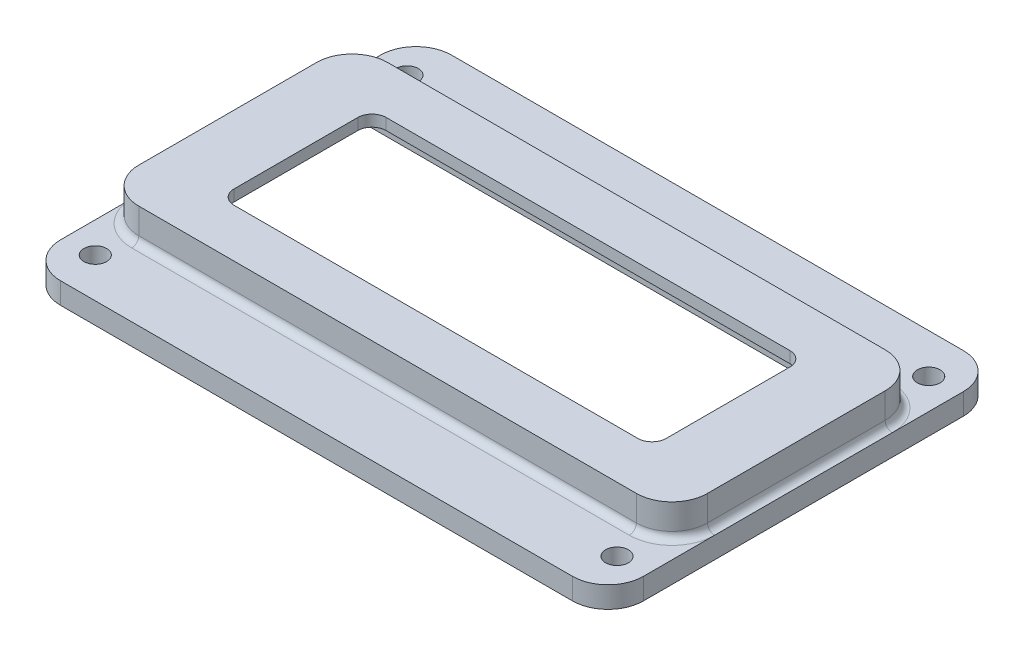
from build123d import *

# Parameters (mm, degrees)
SKETCH1_W           = 104.14
SKETCH1_H           = 69.85
BOSS_EXTRUDE1_DEPTH = 3.81
SKETCH2_W           = 101.6
SKETCH2_H           = 44.45
BOSS_EXTRUDE2_DEPTH = 5.842
SKETCH4_W           = 97.536
SKETCH4_H           = 40.64
CUT_EXTRUDE1_DEPTH  = 7.62
SKETCH5_W           = 77.216
SKETCH5_H           = 27.178
CUT_EXTRUDE2_DEPTH  = 5.842
FILLET1_R           = 2.54
FILLET2_R           = 6.35
FILLET3_R           = 1.27
SKETCH6_R           = 2.032
CUT_EXTRUDE3_DEPTH  = 5.842
FILLET4_R           = 1.27


with BuildPart() as part:
    # Sketch1 → Boss-Extrude1 (new body)
    with BuildSketch(Plane(origin=(0, 0, 0), x_dir=(1, 0, 0), z_dir=(0, 1, 0))):
        Rectangle(SKETCH1_W, SKETCH1_H)
    extrude(amount=BOSS_EXTRUDE1_DEPTH)

    # Sketch2 → Boss-Extrude2 (add)
    with BuildSketch(Plane(origin=(0, 3.81, 0), x_dir=(1, 0, 0), z_dir=(0, 1, 0))):
        Rectangle(SKETCH2_W, SKETCH2_H)
    extrude(amount=BOSS_EXTRUDE2_DEPTH)

    # Sketch4 → Cut-Extrude1 (cut)
    with BuildSketch(Plane.XZ):
        Rectangle(SKETCH4_W, SKETCH4_H)
    extrude(amount=-CUT_EXTRUDE1_DEPTH, mode=Mode.SUBTRACT)

    # Sketch5 → Cut-Extrude2 (cut)
    with BuildSketch(Plane.XZ.offset(-7.62)):
        Rectangle(SKETCH5_W, SKETCH5_H)
    extrude(amount=-CUT_EXTRUDE2_DEPTH, mode=Mode.SUBTRACT)

    # Fillet1
    fillet1_edges = [part.edges().sort_by_distance(p)[0] for p in [
        (-38.608, 8.636, -13.589),
        (-38.608, 8.636, 13.589),
        (38.608, 8.636, 13.589),
        (38.608, 8.636, -13.589),
    ]]
    fillet(fillet1_edges, radius=FILLET1_R)

    # Fillet2
    fillet2_edges = [part.edges().sort_by_distance(p)[0] for p in [
        (50.8, 6.731, 22.225),
        (50.8, 6.731, -22.225),
        (-50.8, 6.731, -22.225),
        (-50.8, 6.731, 22.225),
        (-52.07, 1.905, -34.925),
        (52.07, 1.905, -34.925),
        (52.07, 1.905, 34.925),
        (-52.07, 1.905, 34.925),
    ]]
    fillet(fillet2_edges, radius=FILLET2_R)

    # Fillet3
    fillet3_edges = [part.edges().sort_by_distance(p)[0] for p in [
        (0, 3.81, -22.225),
        (50.8, 3.81, 0),
        (0, 3.81, 22.225),
        (-50.8, 3.81, 0),
        (48.940128061, 3.81, -20.365128061),
        (-48.940128061, 3.81, -20.365128061),
        (-48.940128061, 3.81, 20.365128061),
        (48.940128061, 3.81, 20.365128061),
    ]]
    fillet(fillet3_edges, radius=FILLET3_R - 0.0001)  # a hair under: the kernel refuses the full size

    # Sketch6 → Cut-Extrude3 (cut)
    with BuildSketch(Plane(origin=(0, 3.81, 0), x_dir=(1, 0, 0), z_dir=(0, 1, 0))):
        with Locations(Location((-46.609, 27.84475, 0), (0, 0, 270))):
            Circle(SKETCH6_R)
        with Locations(Location((46.609, 27.84475, 0), (0, 0, 270))):
            Circle(SKETCH6_R)
        with Locations(Location((46.609, -27.84475, 0), (0, 0, 270))):
            Circle(SKETCH6_R)
        with Locations(Location((-46.609, -27.84475, 0), (0, 0, 270))):
            Circle(SKETCH6_R)
    extrude(amount=-CUT_EXTRUDE3_DEPTH, mode=Mode.SUBTRACT)

    # Fillet4
    fillet4_edges = [part.edges().sort_by_distance(p)[0] for p in [
        (-48.768, 3.81, -20.32),
        (-48.768, 3.81, 20.32),
        (48.768, 3.81, 20.32),
        (48.768, 3.81, -20.32),
    ]]
    fillet(fillet4_edges, radius=FILLET4_R)


solid = part.part
